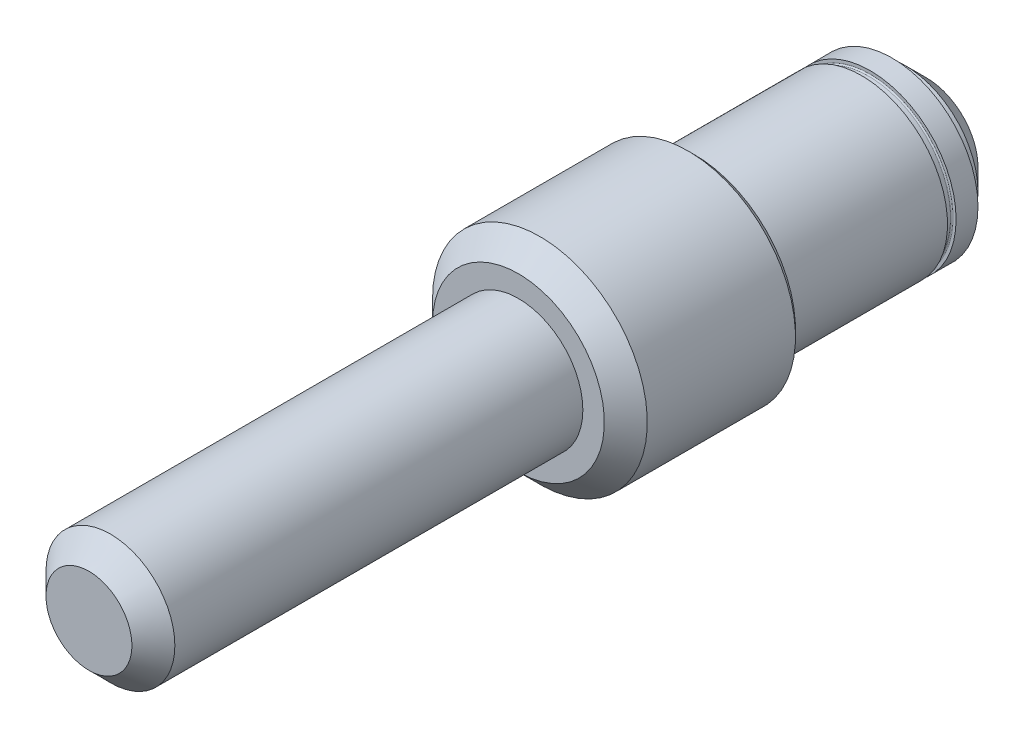
from build123d import *

# Parameters (mm, degrees)
CHAMFER_1_SIZE      = 5
SKETCH_4_R          = 20
SKETCH_4_R_2        = 19
CUT_EXTRUDE_1_DEPTH = 2
FILLET_1_R          = 0.3
CHAMFER_2_SIZE      = 1.5
SKETCH_9_R          = 25
SKETCH_9_R_2        = 20
CUT_EXTRUDE_4_DEPTH = 6
CHAMFER_3_SIZE      = 1.5


with BuildPart() as part:
    # Эскиз1 → Повернуть1 (revolve)
    with BuildSketch(Plane(origin=(0, 0, 0), x_dir=(0, 0, -1), z_dir=(1, 0, 0))):
        Polygon((0, 0), (0, 15), (100, 15), (100, 25), (147, 25), (147, 20), (187, 20), (187, 17), (195, 17), (195, 5), (190, 0), align=None)
    revolve(axis=Axis((0, 0, 0), (0, 0, -1)))

    # Фаска1
    chamfer_1_edges = [part.edges().sort_by_distance(p)[0] for p in [
        (0, -25, -100),
        (0, -15, 0),
        (0, -17, -195),
    ]]
    chamfer(chamfer_1_edges, length=CHAMFER_1_SIZE)

    # Эскиз4 → Вырез-Вытянуть1 (cut)
    with BuildSketch(Plane(origin=(0, 0, -181.9), x_dir=(-1, 0, 0), z_dir=(0, 0, -1))):
        Circle(SKETCH_4_R)
        Circle(SKETCH_4_R_2, mode=Mode.SUBTRACT)
    extrude(amount=-CUT_EXTRUDE_1_DEPTH, mode=Mode.SUBTRACT)

    # Скругление1
    fillet_1_edges = [part.edges().sort_by_distance(p)[0] for p in [
        (19, 0, -179.9),
        (19, 0, -181.9),
    ]]
    fillet(fillet_1_edges, radius=FILLET_1_R)

    # Фаска2
    chamfer_2_edges = [part.edges().sort_by_distance(p)[0] for p in [
        (0, -25, -147),
    ]]
    chamfer(chamfer_2_edges, length=CHAMFER_2_SIZE)

    # Эскиз9 → Вырез-Вытянуть4 (cut)
    with BuildSketch(Plane(origin=(0, 0, -147), x_dir=(-1, 0, 0), z_dir=(0, 0, -1))):
        Circle(SKETCH_9_R)
        Circle(SKETCH_9_R_2, mode=Mode.SUBTRACT)
    extrude(amount=-CUT_EXTRUDE_4_DEPTH, mode=Mode.SUBTRACT)

    # Фаска3
    chamfer_3_edges = [part.edges().sort_by_distance(p)[0] for p in [
        (0, -25, -141),
    ]]
    chamfer(chamfer_3_edges, length=CHAMFER_3_SIZE)


solid = part.part
